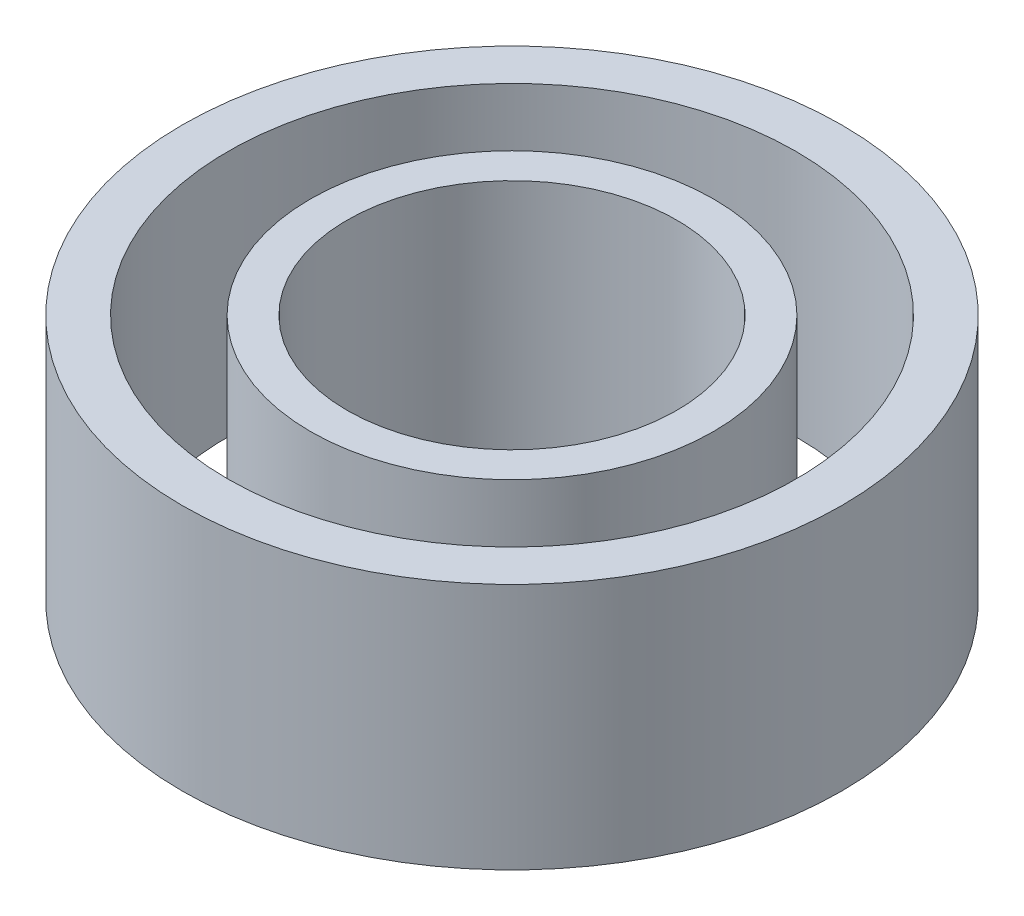
from build123d import *

# Parameters (mm, degrees)
SKETCH1_R           = 4
BOSS_EXTRUDE2_DEPTH = 3
SKETCH3_R           = 2
CUT_EXTRUDE2_DEPTH  = 3
SKETCH4_R           = 3.44443066
SKETCH4_R_2         = 2.44443066
CUT_EXTRUDE3_DEPTH  = 3


with BuildPart() as part:
    # Sketch1 → Boss-Extrude2 (new body)
    with BuildSketch(Plane(origin=(0, 0, 0), x_dir=(1, 0, 0), z_dir=(0, 1, 0))):
        Circle(SKETCH1_R)
    extrude(amount=BOSS_EXTRUDE2_DEPTH)

    # Sketch3 → Cut-Extrude2 (cut)
    with BuildSketch(Plane(origin=(0, 3, 0), x_dir=(1, 0, 0), z_dir=(0, 1, 0))):
        Circle(SKETCH3_R)
    extrude(amount=-CUT_EXTRUDE2_DEPTH, mode=Mode.SUBTRACT)

    # Sketch4 → Cut-Extrude3 (cut)
    with BuildSketch(Plane(origin=(0, 3, 0), x_dir=(1, 0, 0), z_dir=(0, 1, 0))):
        Circle(SKETCH4_R)
        Circle(SKETCH4_R_2, mode=Mode.SUBTRACT)
    extrude(amount=-CUT_EXTRUDE3_DEPTH, mode=Mode.SUBTRACT)


with BuildPart() as cut_extrude3_piece_1:
    # of the separate pieces the step leaves, piece 1, a body of its own (cut_extrude3_pieces)
    add(part.part.solids().sort_by_distance((4, 0, 0))[0])


with BuildPart() as cut_extrude3_piece_2:
    # of the separate pieces the step leaves, piece 2, a body of its own (cut_extrude3_pieces)
    add(part.part.solids().sort_by_distance((2.44443066, 0, 0))[0])


solid = Compound([cut_extrude3_piece_1.part, cut_extrude3_piece_2.part])
